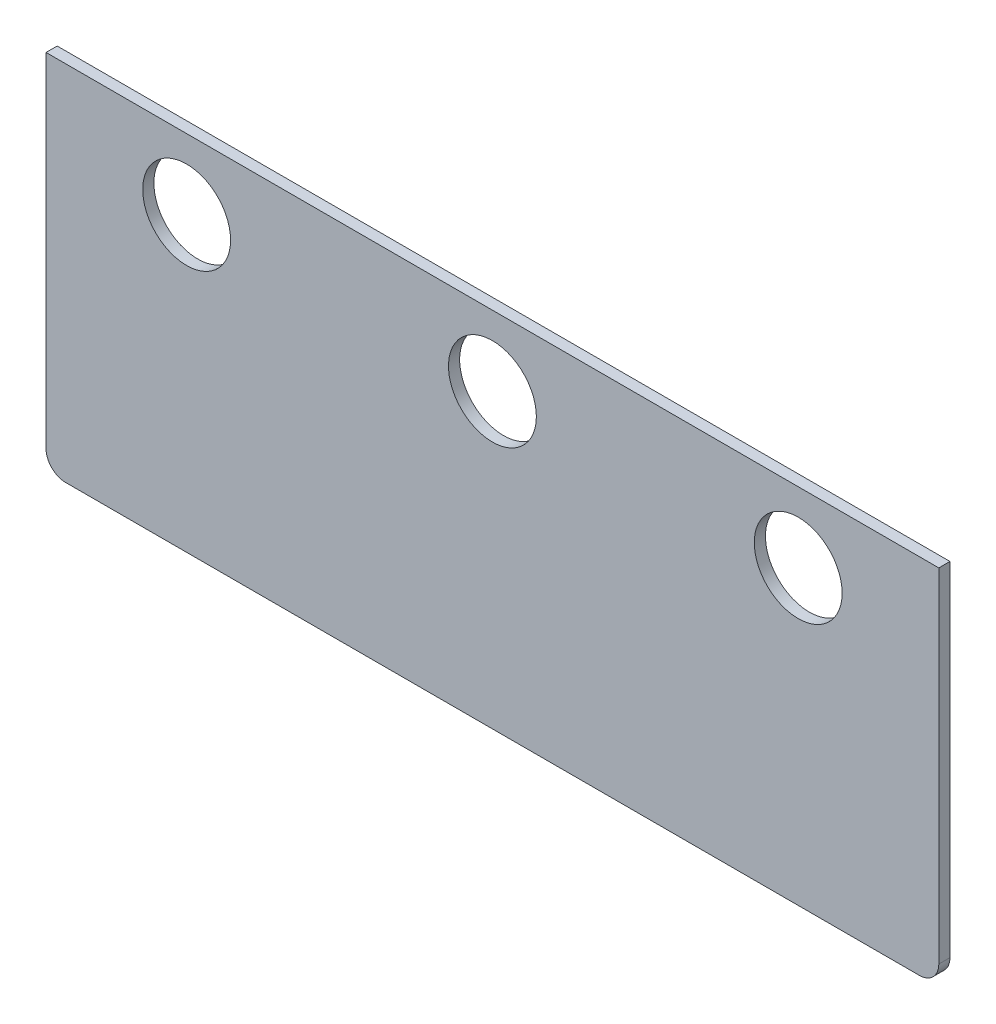
from build123d import *

# Parameters (mm, degrees)
SKETCH1_W           = 254
SKETCH1_H           = 103.175
SKETCH1_R           = 12.5
BOSS_EXTRUDE1_DEPTH = 3.175
FILLET1_R           = 5.55625


with BuildPart() as part:
    # Sketch1 → Boss-Extrude1 (new body)
    with BuildSketch(Plane.XY):
        with Locations((0, 51.5875)):
            Rectangle(SKETCH1_W, SKETCH1_H)
        with Locations((87, 83.175)):
            Circle(SKETCH1_R, mode=Mode.SUBTRACT)
        with Locations((-87, 83.175)):
            Circle(SKETCH1_R, mode=Mode.SUBTRACT)
        with Locations((0, 83.175)):
            Circle(SKETCH1_R, mode=Mode.SUBTRACT)
    extrude(amount=BOSS_EXTRUDE1_DEPTH)

    # Fillet1
    fillet1_edges = [part.edges().sort_by_distance(p)[0] for p in [
        (127, 0, 1.5875),
        (-127, 0, 1.5875),
    ]]
    fillet(fillet1_edges, radius=FILLET1_R)


solid = part.part
